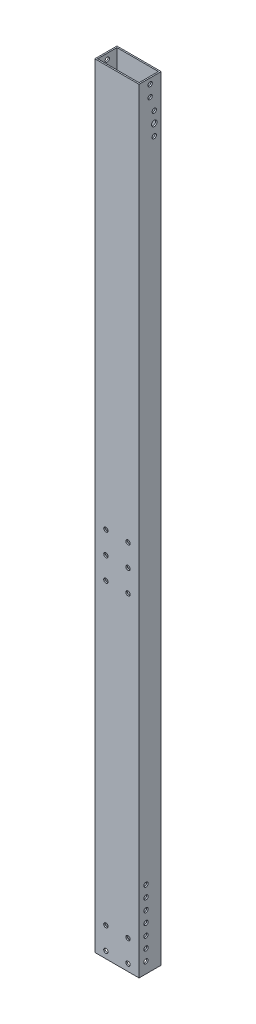
from build123d import *

# Parameters (mm, degrees)
SKETCH1_W               = 50.8
SKETCH1_H               = 889
BOSS_EXTRUDE1_DEPTH     = 12.7
SHELL1_T                = -1.5875
CUT_EXTRUDE1_DEPTH      = 446.406219085
CUT_EXTRUDE1_DEPTH_BACK = 446.406219085
SKETCH3_R               = 2.4892
CUT_EXTRUDE2_DEPTH      = 446.406219085
CUT_EXTRUDE2_DEPTH_BACK = 446.406219085
SKETCH4_R               = 3.175
SKETCH4_R_2             = 2.4892
SKETCH5_W               = 31.75
SKETCH5_H               = 26.9875
CUT_EXTRUDE3_DEPTH      = 446.406219085
FILLET1_R               = 3.175
CUT_EXTRUDE4_DEPTH      = 446.406219085
CUT_EXTRUDE4_DEPTH_BACK = 446.406219085
SKETCH6_R               = 2.4892
CUT_EXTRUDE5_DEPTH      = 446.406219085
CUT_EXTRUDE5_DEPTH_BACK = 446.406219085
SKETCH7_R               = 2.4892


with BuildPart() as part:
    # Sketch1 → Boss-Extrude1 (new, symmetric)
    with BuildSketch(Plane.XY):
        Rectangle(SKETCH1_W, SKETCH1_H)
    extrude(amount=BOSS_EXTRUDE1_DEPTH, both=True)

    # Shell1
    shell1_openings = [part.faces().sort_by_distance(p)[0] for p in [
        (0, -444.5, 0),
        (0, 444.5, 0),
    ]]
    offset(amount=SHELL1_T, openings=shell1_openings, kind=Kind.INTERSECTION)

    # Sketch3 → Cut-Extrude1 (cut, two sides: drawn at the far end of the back side and taken through both)
    with BuildSketch(Plane(origin=(0, 0, 0), x_dir=(0, 0, -1), z_dir=(1, 0, 0)).offset(-CUT_EXTRUDE1_DEPTH_BACK)):
        with Locations((0, 425.45)):
            Circle(SKETCH3_R)
        with Locations((0, 438.15)):
            Circle(SKETCH3_R)
    extrude(amount=CUT_EXTRUDE1_DEPTH + CUT_EXTRUDE1_DEPTH_BACK, mode=Mode.SUBTRACT)

    # Sketch4 → Cut-Extrude2 (cut, two sides: drawn at the far end of the back side and taken through both)
    with BuildSketch(Plane(origin=(0, 0, 0), x_dir=(0, 0, -1), z_dir=(1, 0, 0)).offset(-CUT_EXTRUDE2_DEPTH_BACK)):
        with Locations((4.7625, 396.875)):
            Circle(SKETCH4_R)
        with Locations((4.7625, 409.575)):
            Circle(SKETCH4_R_2)
        with Locations((4.7625, 384.175)):
            Circle(SKETCH4_R_2)
    extrude(amount=CUT_EXTRUDE2_DEPTH + CUT_EXTRUDE2_DEPTH_BACK, mode=Mode.SUBTRACT)

    # Sketch5 → Cut-Extrude3 (cut, through all)
    with BuildSketch(Plane.XY):
        with Locations((0, 396.875)):
            Rectangle(SKETCH5_W, SKETCH5_H)
    extrude(amount=-CUT_EXTRUDE3_DEPTH, mode=Mode.SUBTRACT)

    # Fillet1
    fillet1_edges = [part.edges().sort_by_distance(p)[0] for p in [
        (15.875, 410.36875, -11.90625),
        (15.875, 383.38125, -11.90625),
        (-15.875, 383.38125, -11.90625),
        (-15.875, 410.36875, -11.90625),
    ]]
    fillet(fillet1_edges, radius=FILLET1_R)

    # Sketch6 → Cut-Extrude4 (cut, two sides: drawn at the far end of the back side and taken through both)
    with BuildSketch(Plane.XY.offset(-CUT_EXTRUDE4_DEPTH_BACK)):
        with Locations((-12.7, -17.4625)):
            Circle(SKETCH6_R)
        with Locations((12.7, -17.4625)):
            Circle(SKETCH6_R)
        with Locations((12.7, -42.8625)):
            Circle(SKETCH6_R)
        with Locations((12.7, -68.2625)):
            Circle(SKETCH6_R)
        with Locations((-12.7, -42.8625)):
            Circle(SKETCH6_R)
        with Locations((-12.7, -68.2625)):
            Circle(SKETCH6_R)
        with Locations((-12.7, -436.5625)):
            Circle(SKETCH6_R)
        with Locations((12.7, -436.5625)):
            Circle(SKETCH6_R)
        with Locations((12.7, -411.1625)):
            Circle(SKETCH6_R)
        with Locations((-12.7, -411.1625)):
            Circle(SKETCH6_R)
    extrude(amount=CUT_EXTRUDE4_DEPTH + CUT_EXTRUDE4_DEPTH_BACK, mode=Mode.SUBTRACT)

    # Sketch7 → Cut-Extrude5 (cut, two sides: drawn at the far end of the back side and taken through both)
    with BuildSketch(Plane(origin=(0, 0, 0), x_dir=(0, 0, -1), z_dir=(1, 0, 0)).offset(-CUT_EXTRUDE5_DEPTH_BACK)):
        with Locations((-4.7625, -431.8)):
            Circle(SKETCH7_R)
        with Locations((-4.7625, -419.1)):
            Circle(SKETCH7_R)
        with Locations((-4.7625, -406.4)):
            Circle(SKETCH7_R)
        with Locations((-4.7625, -393.7)):
            Circle(SKETCH7_R)
        with Locations((-4.7625, -381)):
            Circle(SKETCH7_R)
        with Locations((-4.7625, -368.3)):
            Circle(SKETCH7_R)
        with Locations((-4.7625, -355.6)):
            Circle(SKETCH7_R)
    extrude(amount=CUT_EXTRUDE5_DEPTH + CUT_EXTRUDE5_DEPTH_BACK, mode=Mode.SUBTRACT)


solid = part.part
